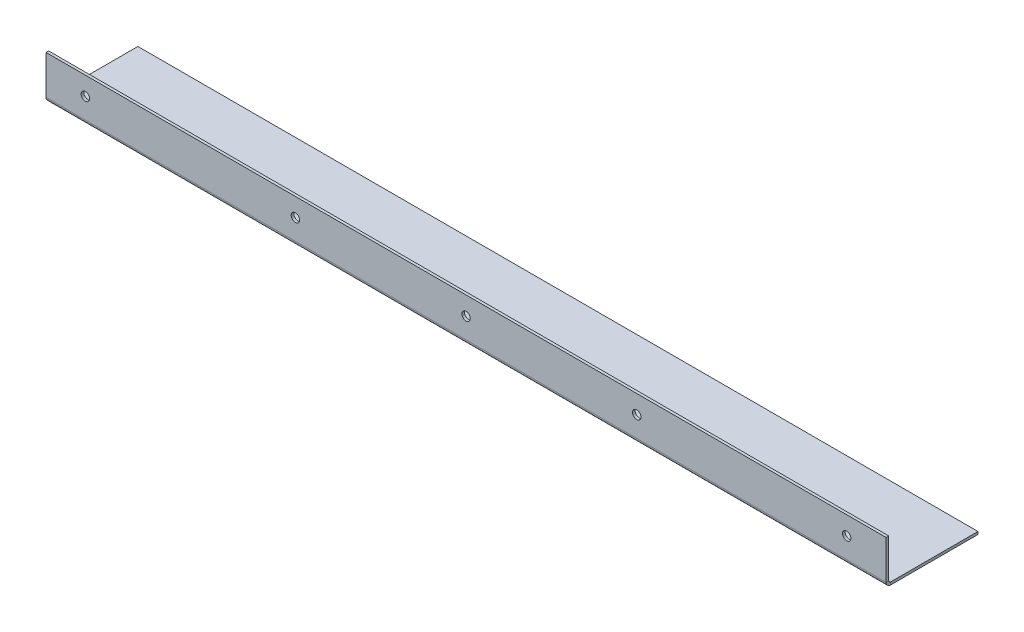
from build123d import *

# Parameters (mm, degrees)
SKETCH_1_W             = 50
SKETCH_1_H             = 1
SM_BASE_FLANGE_1_DEPTH = 160
OTHER_START            = -160
OTHER_1_DEPTH          = 320
OTHER_1_2_DEPTH        = 320
SKETCH_4_R             = 1.6
CUT_EXTRUDE_1_DEPTH    = 2


# Read off the part's stored shape, not the designer's step: 绘制的折弯1
# Sheet-metal steps are written as plain solids
with BuildPart() as part:
    # Sketch 1 → 基体-法兰1 (new, symmetric)
    with BuildSketch(Plane(origin=(0, 0, 0), x_dir=(0, 0, -1), z_dir=(1, 0, 0))):
        with Locations((-7, 22.5)):
            Rectangle(SKETCH_1_W, SKETCH_1_H)
    extrude(amount=SM_BASE_FLANGE_1_DEPTH, both=True)

    # Other 1 outline → Other 1 (cut)
    with BuildSketch(Plane.YZ.offset(OTHER_START)):
        with BuildLine():
            ThreePointArc((22, 15.2634), (22.271171885, 16.195226164), (23, 16.83604109))
            Line((23, 16.83604109), (23, 32))
            Line((23, 32), (22, 32))
            Line((22, 32), (22, 15.2634))
        make_face()
    extrude(amount=OTHER_1_DEPTH, mode=Mode.SUBTRACT)

    # Other 1 2 outline → Other 1 2 (add)
    with BuildSketch(Plane.YZ.offset(OTHER_START)):
        with BuildLine():
            ThreePointArc((23, 15.2634), (23.215745145, 15.784254855), (23.7366, 16))
            Line((23.7366, 16), (38.530753262, 16))
            Line((38.530753262, 16), (38.530753262, 17))
            Line((38.530753262, 17), (23.7366, 17))
            ThreePointArc((23.7366, 17), (23.359286442, 16.958514757), (23, 16.83604109))
            Line((23, 16.83604109), (23, 15.2634))
        make_face()
    extrude(amount=OTHER_1_2_DEPTH)

    # 草图4 → 切除-拉伸1 (cut)
    with BuildSketch(Plane(origin=(0, 0, 16), x_dir=(-1, 0, 0), z_dir=(0, 0, -1))):
        with Locations(Location((0, 31.530753262, 0), (0, 0, 90))):
            Circle(SKETCH_4_R)
        with Locations(Location((145, 31.530753262, 0), (0, 0, 90))):
            Circle(SKETCH_4_R)
        with Locations(Location((65, 31.530753262, 0), (0, 0, 90))):
            Circle(SKETCH_4_R)
        with Locations(Location((-145, 31.530753262, 0), (0, 0, 90))):
            Circle(SKETCH_4_R)
        with Locations(Location((-65, 31.530753262, 0), (0, 0, 90))):
            Circle(SKETCH_4_R)
    extrude(amount=-CUT_EXTRUDE_1_DEPTH, mode=Mode.SUBTRACT)


solid = part.part
